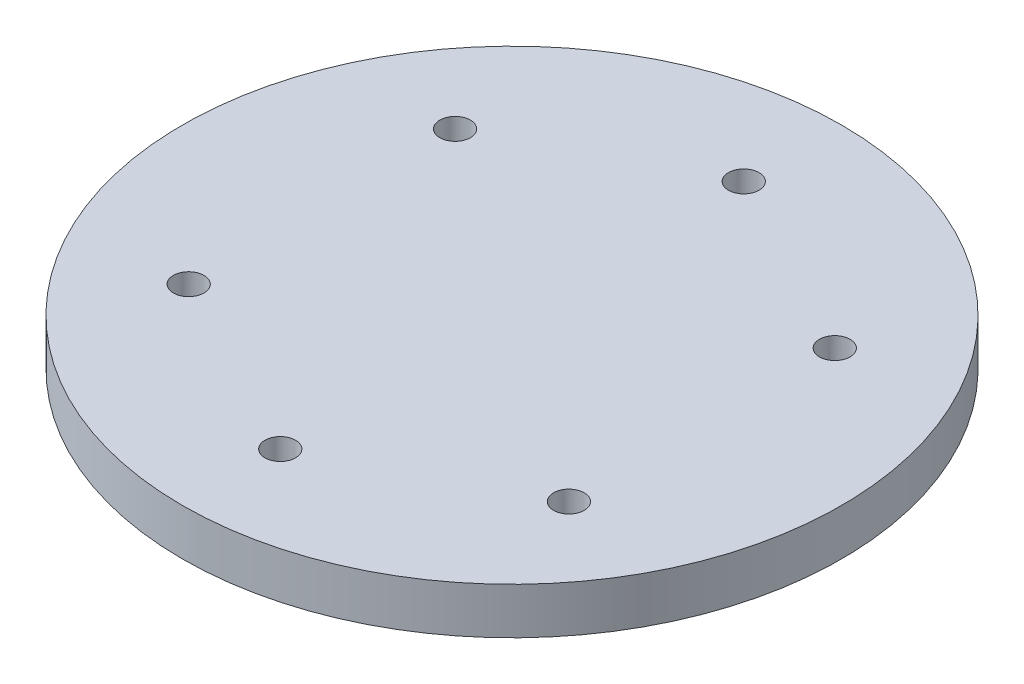
from build123d import *

# Parameters (mm, degrees)
SKETCH1_R           = 35.55
BOSS_EXTRUDE1_DEPTH = 5
SKETCH2_R           = 1.65
CUT_EXTRUDE1_DEPTH  = 10


with BuildPart() as part:
    # Sketch1 → Boss-Extrude1 (new body)
    with BuildSketch(Plane(origin=(0, 0, 0), x_dir=(1, 0, 0), z_dir=(0, 1, 0))):
        Circle(SKETCH1_R)
    extrude(amount=BOSS_EXTRUDE1_DEPTH)

    # Sketch2 → Cut-Extrude1 (cut)
    with BuildSketch(Plane(origin=(0, 5, 0), x_dir=(1, 0, 0), z_dir=(0, 1, 0))):
        with Locations((0, 25)):
            Circle(SKETCH2_R)
        with Locations((-20.478801107, 14.339410909)):
            Circle(SKETCH2_R)
        with Locations((20.478801107, 14.339410909)):
            Circle(SKETCH2_R)
        with Locations((20.478801107, -14.339410909)):
            Circle(SKETCH2_R)
        with Locations((0, -25)):
            Circle(SKETCH2_R)
        with Locations((-20.3386694, -14.537486957)):
            Circle(SKETCH2_R)
    extrude(amount=-CUT_EXTRUDE1_DEPTH, mode=Mode.SUBTRACT)


solid = part.part
